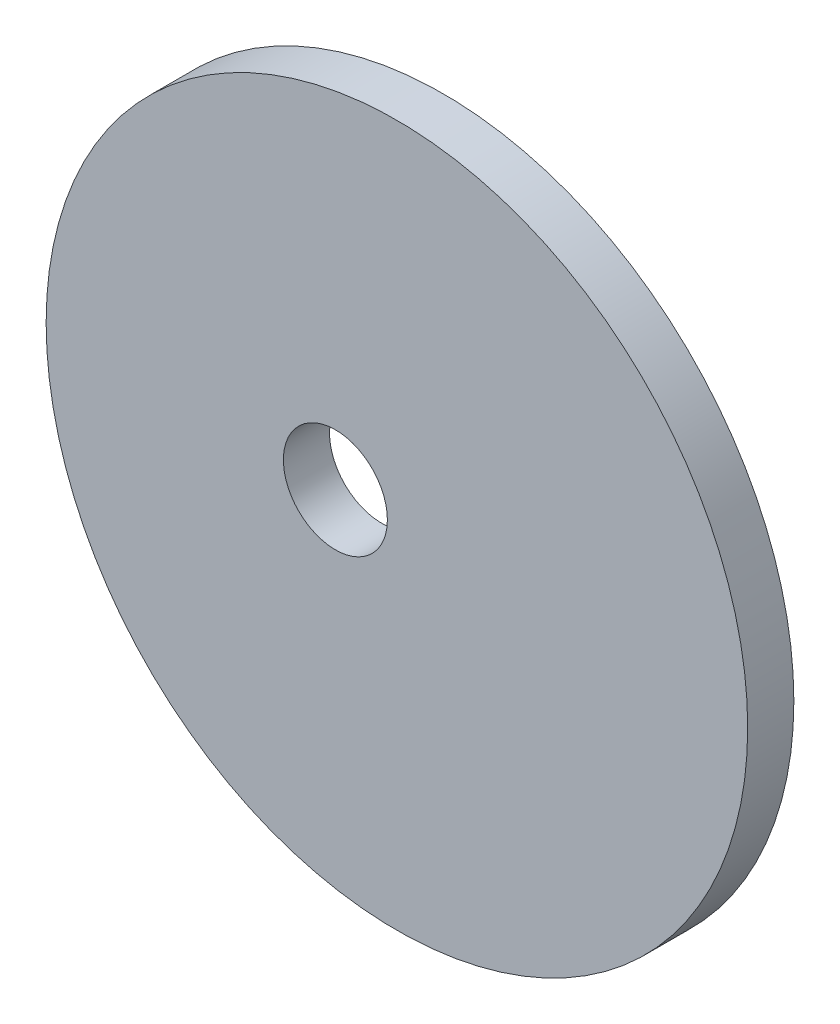
from build123d import *

# Parameters (mm, degrees)
SKETCH1_R           = 22.8
SKETCH1_R_2         = 3.38
BOSS_EXTRUDE5_DEPTH = 3


with BuildPart() as part:
    # Sketch1 → Boss-Extrude5 (new body)
    with BuildSketch(Plane.XY):
        Circle(SKETCH1_R)
        with Locations((-4, 0)):
            Circle(SKETCH1_R_2, mode=Mode.SUBTRACT)
    extrude(amount=BOSS_EXTRUDE5_DEPTH)


solid = part.part
